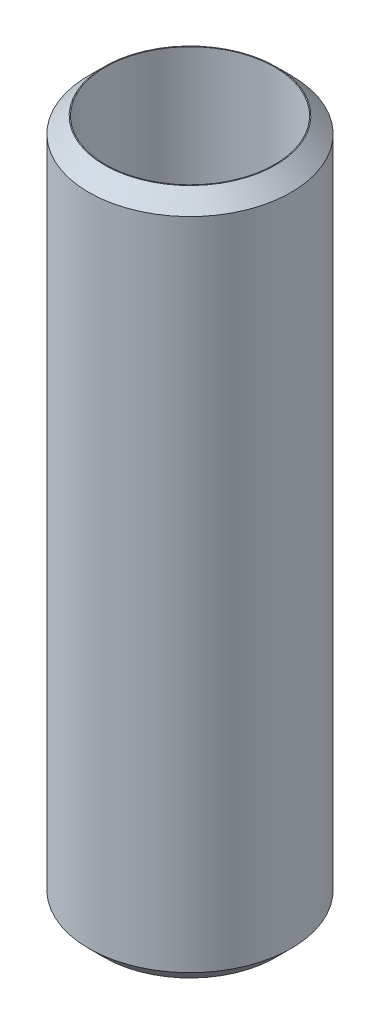
from build123d import *

# Parameters (mm, degrees)
SKETCH1_R           = 35
BOSS_EXTRUDE1_DEPTH = 237.281671656
SKETCH2_R           = 29.251641566
CUT_EXTRUDE1_DEPTH  = 243.389339089
CHAMFER1_SIZE       = 5.44419396


with BuildPart() as part:
    # Sketch1 → Boss-Extrude1 (new body)
    with BuildSketch(Plane(origin=(0, 0, 0), x_dir=(1, 0, 0), z_dir=(0, 1, 0))):
        Circle(SKETCH1_R)
    extrude(amount=BOSS_EXTRUDE1_DEPTH)

    # Sketch2 → Cut-Extrude1 (cut, through all)
    with BuildSketch(Plane(origin=(0, 0, 0), x_dir=(1, 0, 0), z_dir=(0, 1, 0))):
        Circle(SKETCH2_R)
    extrude(amount=CUT_EXTRUDE1_DEPTH, mode=Mode.SUBTRACT)

    # Chamfer1
    chamfer1_edges = [part.edges().sort_by_distance(p)[0] for p in [
        (-35, 237.281671656, 0),
        (-35, 0, 0),
    ]]
    chamfer(chamfer1_edges, length=CHAMFER1_SIZE)


solid = part.part
